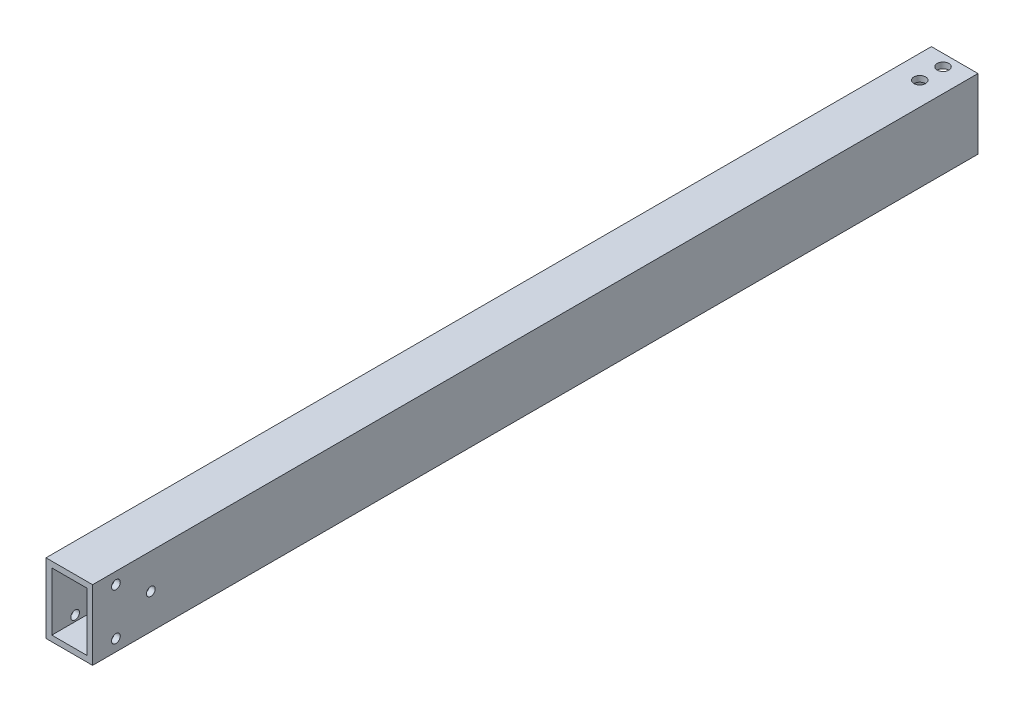
from build123d import *

# Parameters (mm, degrees)
SKETCH1_W           = 25.4
SKETCH1_H           = 38.1
SKETCH1_W_2         = 19.05
SKETCH1_H_2         = 31.75
BOSS_EXTRUDE1_DEPTH = 482.6
SKETCH2_R           = 3.175
CUT_EXTRUDE1_DEPTH  = 485.268169509
SKETCH3_R           = 2.38125
CUT_EXTRUDE2_DEPTH  = 484.643280218
SKETCH4_R           = 2.38125
CUT_EXTRUDE3_DEPTH  = 484.643280218


with BuildPart() as part:
    # Sketch1 → Boss-Extrude1 (new body)
    with BuildSketch(Plane.XY):
        Rectangle(SKETCH1_W, SKETCH1_H)
        Rectangle(SKETCH1_W_2, SKETCH1_H_2, mode=Mode.SUBTRACT)
    extrude(amount=BOSS_EXTRUDE1_DEPTH)

    # Sketch2 → Cut-Extrude1 (cut, through all)
    with BuildSketch(Plane(origin=(0, 19.05, 0), x_dir=(1, 0, 0), z_dir=(0, 1, 0))):
        with Locations((0, -19.05)):
            Circle(SKETCH2_R)
        with Locations((0, -6.35)):
            Circle(SKETCH2_R)
    extrude(amount=-CUT_EXTRUDE1_DEPTH, mode=Mode.SUBTRACT)

    # Sketch3 → Cut-Extrude2 (cut, through all)
    with BuildSketch(Plane.ZY.offset(12.7)):
        with Locations((469.9, -12.7)):
            Circle(SKETCH3_R)
        with Locations((469.9, 12.7)):
            Circle(SKETCH3_R)
    extrude(amount=-CUT_EXTRUDE2_DEPTH, mode=Mode.SUBTRACT)

    # Sketch4 → Cut-Extrude3 (cut, through all)
    with BuildSketch(Plane.ZY.offset(12.7)):
        with Locations((450.85, 0)):
            Circle(SKETCH4_R)
    extrude(amount=-CUT_EXTRUDE3_DEPTH, mode=Mode.SUBTRACT)


solid = part.part
